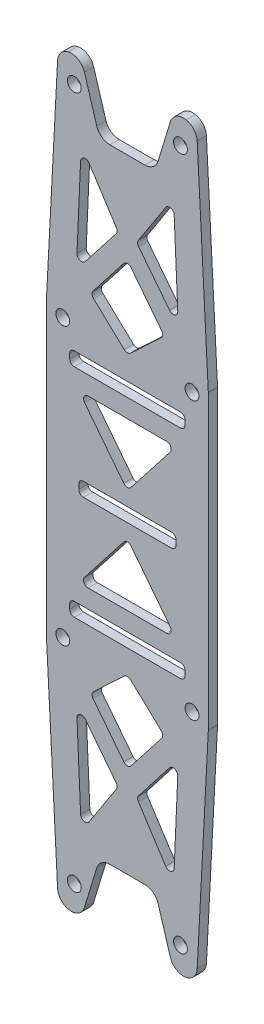
from build123d import *

# Parameters (mm, degrees)
CROQUIS1_R              = 1.5
SALIENTE_EXTRUIR1_DEPTH = 2
CROQUIS2_W              = 25
CROQUIS2_H              = 3
CROQUIS2_W_2            = 21.071847778
CORTAR_EXTRUIR1_DEPTH   = 2
REDONDEO2_R             = 1
REDONDEO1_R             = 3


with BuildPart() as part:
    # Croquis1 → Saliente-Extruir1 (new body)
    with BuildSketch(Plane.XY):
        Polygon((-17.535923889, 31.688251973), (-15, 80), (0, 83), (15, 80), (17.535923889, 31.688251973), (17.535923889, -31.688251973), (15, -80), (0, -83), (-15, -80), (-17.535923889, -31.688251973), align=None)
        with Locations((-11.5, 75)):
            Circle(CROQUIS1_R, mode=Mode.SUBTRACT)
        with Locations((11.5, 75)):
            Circle(CROQUIS1_R, mode=Mode.SUBTRACT)
        with Locations((14, 30)):
            Circle(CROQUIS1_R, mode=Mode.SUBTRACT)
        with Locations((-14, 30)):
            Circle(CROQUIS1_R, mode=Mode.SUBTRACT)
        with Locations((-14, -30)):
            Circle(CROQUIS1_R, mode=Mode.SUBTRACT)
        with Locations((14, -30)):
            Circle(CROQUIS1_R, mode=Mode.SUBTRACT)
        with Locations((-11.5, -75)):
            Circle(CROQUIS1_R, mode=Mode.SUBTRACT)
        with Locations((11.5, -75)):
            Circle(CROQUIS1_R, mode=Mode.SUBTRACT)
    extrude(amount=SALIENTE_EXTRUIR1_DEPTH)

    # Croquis2 → Cortar-Extruir1 (cut)
    with BuildSketch(Plane.XY.offset(2)):
        Polygon((-10.097096622, 80.980580676), (-6, 67.5), (6, 67.5), (10.097096622, 80.980580676), (0, 83), align=None)
        Polygon((-10, 64.432841453), (-11.051306944, 40.455878474), (-2, 52.07053953), align=None)
        Polygon((2, 52.07053953), (10, 64.432841453), (11.051306944, 40.455878474), align=None)
        Polygon((0, 30), (-8, 37.5), (0, 47.7656212), (8, 37.5), align=None)
        Polygon((-10.535923889, 18), (10.535923889, 18), (0, 4.5), align=None)
        with Locations((0, 23.5)):
            Rectangle(CROQUIS2_W, CROQUIS2_H)
        Rectangle(CROQUIS2_W_2, CROQUIS2_H)
        Polygon((0, -4.5), (10.535923889, -18), (-10.535923889, -18), align=None)
        with Locations((0, -23.5)):
            Rectangle(CROQUIS2_W, CROQUIS2_H)
        Polygon((8, -37.5), (0, -47.7656212), (-8, -37.5), (0, -30), align=None)
        Polygon((11.051306944, -40.455878474), (2, -52.07053953), (10, -64.432841453), align=None)
        Polygon((-2, -52.07053953), (-10, -64.432841453), (-11.051306944, -40.455878474), align=None)
        Polygon((10.097096622, -80.980580676), (0, -83), (-10.097096622, -80.980580676), (-6, -67.5), (6, -67.5), align=None)
    extrude(amount=-CORTAR_EXTRUIR1_DEPTH, mode=Mode.SUBTRACT)

    # Redondeo2
    redondeo2_edges = [part.edges().sort_by_distance(p)[0] for p in [
        (-12.5, 22, 1),
        (-12.5, 25, 1),
        (12.5, 25, 1),
        (12.5, 22, 1),
        (11.051306944, 40.455878474, 1),
        (2, 52.07053953, 1),
        (10, 64.432841453, 1),
        (-10, 64.432841453, 1),
        (-2, 52.07053953, 1),
        (-11.051306944, 40.455878474, 1),
        (0, 47.7656212, 1),
        (8, 37.5, 1),
        (0, 30, 1),
        (-8, 37.5, 1),
        (-10.535923889, -18, 1),
        (0, -4.5, 1),
        (10.535923889, -18, 1),
        (-10.535923889, 1.5, 1),
        (10.535923889, 1.5, 1),
        (10.535923889, -1.5, 1),
        (-10.535923889, -1.5, 1),
        (12.5, -25, 1),
        (-12.5, -25, 1),
        (-12.5, -22, 1),
        (12.5, -22, 1),
        (0, 4.5, 1),
        (-10.535923889, 18, 1),
        (10.535923889, 18, 1),
        (11.051306944, -40.455878474, 1),
        (10, -64.432841453, 1),
        (2, -52.07053953, 1),
        (-8, -37.5, 1),
        (0, -30, 1),
        (8, -37.5, 1),
        (0, -47.7656212, 1),
        (-11.051306944, -40.455878474, 1),
        (-2, -52.07053953, 1),
        (-10, -64.432841453, 1),
    ]]
    fillet(redondeo2_edges, radius=REDONDEO2_R)

    # Redondeo1
    # the kernel refuses this fillet: 3 mm, written as the material it adds along each edge
    with BuildSketch(Plane(origin=(-6, -67.5, 2), x_dir=(-0.29079205959554133, -0.956786276070149, 0), z_dir=(0, 0, -1)), Plane(origin=(6, -67.5, 2), x_dir=(-1, 0, 0), z_dir=(0, 0, -1)), Plane(origin=(6, 67.5, 2), x_dir=(0.2907920595955413, 0.9567862760701489, 0), z_dir=(0, 0, -1)), Plane(origin=(-6, 67.5, 2), x_dir=(1, 0, 0), z_dir=(0, 0, -1))) as redondeo1_piece_1:
        with BuildLine():
            CenterArc((REDONDEO1_R * 0.741239666728, -REDONDEO1_R), REDONDEO1_R, 90, 73.09461858)
            Line((-REDONDEO1_R * 0.215546609342, -REDONDEO1_R * 0.709207940404), (0, 0))
            Line((0, 0), (REDONDEO1_R * 0.741239666728, 0))
        make_face()
    extrude(amount=2)
    # the kernel refuses this fillet: 3 mm, written as the material it takes off along each edge
    with BuildSketch(Plane(origin=(15, -80, -5.826545773), x_dir=(-0.9805806756909198, -0.1961161351381855, 0), z_dir=(0, 0, 1)), Plane(origin=(-15, -80, -5.826545773), x_dir=(-0.05241866824073038, 0.9986251965676953, 0), z_dir=(0, 0, 1)), Plane(origin=(15, 80, -5.826545773), x_dir=(0.052418668240731464, -0.9986251965676953, 0), z_dir=(0, 0, 1)), Plane(origin=(-15, 80, -5.826545773), x_dir=(0.9805806756909198, 0.19611613513818563, 0), z_dir=(0, 0, 1))) as redondeo1_2_piece_1:
        with BuildLine():
            CenterArc((REDONDEO1_R * 0.776872769711, -REDONDEO1_R), REDONDEO1_R, 90, 75.685321964)
            Line((-REDONDEO1_R * 0.192079653677, -REDONDEO1_R * 0.752752752875), (0, 0))
            Line((0, 0), (REDONDEO1_R * 0.776872769711, 0))
        make_face()
    extrude(amount=13.653091546, mode=Mode.SUBTRACT)
    with BuildSketch(Plane(origin=(10.097096622, -80.980580676, 8.801127509), x_dir=(-0.29079205959554183, 0.9567862760701488, 0), z_dir=(0, 0, -1)), Plane(origin=(-10.097096622, -80.980580676, 8.801127509), x_dir=(-0.98058067569092, 0.1961161351381849, 0), z_dir=(0, 0, -1)), Plane(origin=(10.097096622, 80.980580676, 8.801127509), x_dir=(0.98058067569092, -0.1961161351381849, 0), z_dir=(0, 0, -1)), Plane(origin=(-10.097096622, 80.980580676, 8.801127509), x_dir=(0.29079205959554244, -0.9567862760701485, 0), z_dir=(0, 0, -1))) as redondeo1_2_piece_2:
        with BuildLine():
            CenterArc((REDONDEO1_R * 0.906817001191, REDONDEO1_R), REDONDEO1_R, 185.595448946, 84.404551054)
            Line((-REDONDEO1_R * 0.0884181467465, REDONDEO1_R * 0.902496152332), (0, 0))
            Line((0, 0), (REDONDEO1_R * 0.906817001191, 0))
        make_face()
    extrude(amount=15.602255018, mode=Mode.SUBTRACT)
    with BuildSketch(Plane(origin=(17.535923889, -31.688251973, -0.196705221), x_dir=(-0.052418668240729306, -0.9986251965676954, 0), z_dir=(0, 0, 1)), Plane(origin=(17.535923889, 31.688251973, -0.196705221), x_dir=(0, -1, 0), z_dir=(0, 0, 1)), Plane(origin=(-17.535923889, -31.688251973, -0.196705221), x_dir=(0, 1, 0), z_dir=(0, 0, 1))) as redondeo1_2_piece_3:
        with BuildLine():
            CenterArc((REDONDEO1_R * 0.0262273628546, -REDONDEO1_R), REDONDEO1_R, 90, 3.004745562)
            Line((-REDONDEO1_R * 0.0261913053861, -REDONDEO1_R * 0.0013748034323), (0, 0))
            Line((0, 0), (REDONDEO1_R * 0.0262273628546, 0))
        make_face()
    extrude(amount=2.393410443, mode=Mode.SUBTRACT)
    with BuildSketch(Plane(origin=(-17.535923889, 31.688251973, -0.196705221), x_dir=(0, -1, 0), z_dir=(0, 0, 1))) as redondeo1_2_piece_4:
        with BuildLine():
            CenterArc((REDONDEO1_R * 0.0262273628546, REDONDEO1_R), REDONDEO1_R, 266.995254438, 3.004745562)
            Line((-REDONDEO1_R * 0.0261913053861, REDONDEO1_R * 0.0013748034323), (0, 0))
            Line((0, 0), (REDONDEO1_R * 0.0262273628546, 0))
        make_face()
    extrude(amount=2.393410443, mode=Mode.SUBTRACT)


solid = part.part
